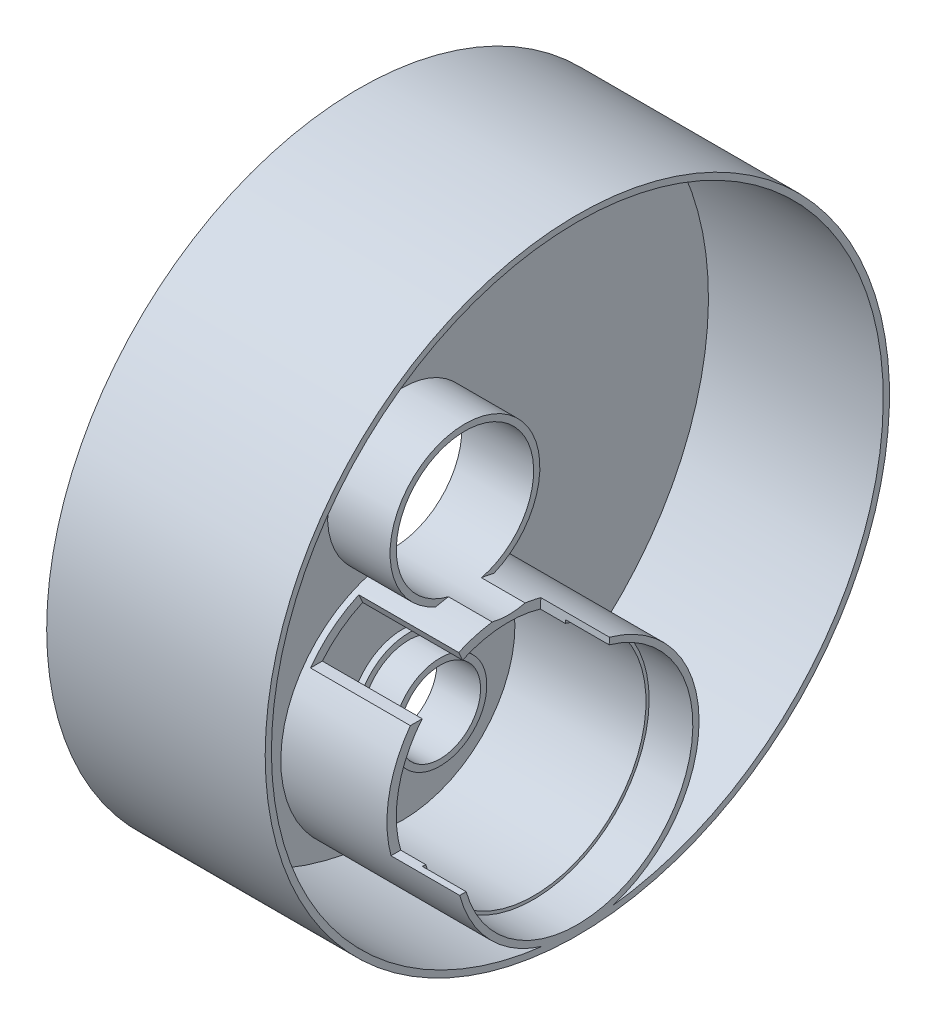
from build123d import *

# Parameters (mm, degrees)
CUT_EXTRUDE_START        = -11
CUT_EXTRUDE_1_DEPTH      = 11
CUT_EXTRUDE_2_DEPTH      = 27
EXTRUDE_START            = -1
SKETCH_4_R               = 50
SKETCH_4_R_2             = 6.5
EXTRUDE_1_DEPTH          = 1
EXTRUDE_2_DEPTH          = 6
EXTRUDE_2_DEPTH_BACK     = 29
SKETCH_5_R               = 50
SKETCH_5_R_2             = 49
EXTRUDE_3_DEPTH          = 1.5
EXTRUDE_3_DEPTH_BACK     = 10
SKETCH_15_R              = 12
SKETCH_15_R_2            = 11
CUT_EXTRUDE_4_DEPTH      = 99.407316801
CUT_EXTRUDE_4_DEPTH_BACK = 99.407316801
SKETCH_16_R              = 11
CUT_EXTRUDE_3_REACH      = 100.697
SKETCH_12_R              = 5
M2X0_41_D                = 1.6
PATTERN_CIRCULAR_1_COUNT = 3


with BuildPart() as part:
    # Эскиз1 → Повернуть1 (revolve)
    with BuildSketch(Plane.XY):
        Polygon((-27, 7.5), (-27, 8.5), (-28, 8.5), (-28, 18), (-7, 18), (-7, 18.5), (0, 18.5), (0, 19.5), (-29, 19.5), (-29, 6.5), (-22, 6.5), (-22, 7.5), align=None)
    revolve(axis=Axis((0, 0, 0), (1, 0, 0)))

    # Эскиз2 → Вырез-Вытянуть1 (cut)
    with BuildSketch(Plane(origin=(0, 0, 0), x_dir=(0, 0, -1), z_dir=(1, 0, 0)).offset(CUT_EXTRUDE_START)):
        with BuildLine():
            Line((5.156251293, 18.805931846), (5, 16.248076809))
            ThreePointArc((5, 16.248076809), (-12.02081528, 12.02081528), (-16.248076809, -5))
            Line((-16.248076809, -5), (-18.848076825, -5))
            ThreePointArc((-18.848076825, -5), (-13.731246096, 13.845680938), (5.156251293, 18.805931846))
        make_face()
    extrude(amount=CUT_EXTRUDE_1_DEPTH, mode=Mode.SUBTRACT)

    # Эскиз3 → Вырез-Вытянуть2 (cut)
    with BuildSketch(Plane(origin=(0, 0, 0), x_dir=(0, 0, -1), z_dir=(1, 0, 0))):
        with BuildLine():
            Line((-40, 11.5), (-12.519984026, 11.5))
            ThreePointArc((-12.519984026, 11.5), (-9.954045186, 13.781037132), (-6.982120022, 15.5))
            Line((-6.982120022, 15.5), (-13.240816858, 29.394032278))
            Line((-13.240816858, 29.394032278), (-40, 11.5))
        make_face()
    extrude(amount=-CUT_EXTRUDE_2_DEPTH, mode=Mode.SUBTRACT)

    # Эскиз4 → Бобышка-Вытянуть1 (add)
    with BuildSketch(Plane.ZY.offset(29).offset(EXTRUDE_START)):
        with Locations((0, 30)):
            Circle(SKETCH_4_R)
        Circle(SKETCH_4_R_2, mode=Mode.SUBTRACT)
    extrude(amount=EXTRUDE_1_DEPTH)

    # Эскиз5 → Бобышка-Вытянуть2 (add, two sides: drawn at the far end of the back side and taken through both)
    with BuildSketch(Plane.ZY.offset(29).offset(-EXTRUDE_2_DEPTH_BACK)):
        with Locations((0, 30)):
            Circle(SKETCH_5_R)
        with Locations((0, 30)):
            Circle(SKETCH_5_R_2, mode=Mode.SUBTRACT)
    extrude(amount=EXTRUDE_2_DEPTH + EXTRUDE_2_DEPTH_BACK)

    # Эскиз15 → Бобышка-Вытянуть3 (add, two sides: drawn at the far end of the back side and taken through both)
    with BuildSketch(Plane.ZY.offset(28).offset(-EXTRUDE_3_DEPTH_BACK)):
        with Locations((0, 30)):
            Circle(SKETCH_15_R)
        with Locations((0, 30)):
            Circle(SKETCH_15_R_2, mode=Mode.SUBTRACT)
    extrude(amount=EXTRUDE_3_DEPTH + EXTRUDE_3_DEPTH_BACK)

    # Эскиз16 → Вырез-Вытянуть4 (cut, two sides: drawn at the far end of the back side and taken through both)
    with BuildSketch(Plane(origin=(-28, 0, 0), x_dir=(0, 0, -1), z_dir=(1, 0, 0)).offset(-CUT_EXTRUDE_4_DEPTH_BACK)):
        with Locations((0, 30)):
            Circle(SKETCH_16_R)
    extrude(amount=CUT_EXTRUDE_4_DEPTH + CUT_EXTRUDE_4_DEPTH_BACK, mode=Mode.SUBTRACT)

    # Эскиз12 → Вырез-Вытянуть3 (cut, up to next)
    with BuildSketch(Plane.ZY.offset(29), mode=Mode.PRIVATE) as cut_extrude_3_sk1:
        with Locations((26.4, 30)):
            Circle(SKETCH_12_R)
    cut_extrude_3_tool1 = extrude(cut_extrude_3_sk1.sketch, amount=-CUT_EXTRUDE_3_REACH, mode=Mode.PRIVATE) & part.part
    add(cut_extrude_3_tool1.solids().sort_by_distance((-29, 30, 26.4))[0], mode=Mode.SUBTRACT)

    # Сверление под метчик M2x0.41 (through all)
    with Locations(Plane.ZY.offset(29)):
        with Locations((26.4, 36.5)):
            m2x0_41 = Hole(M2X0_41_D / 2)

    # Круговой массив1: Сверление под метчик M2x0.41 ×3 about axis
    pattern_circular_1_axis = Axis((0.001, 30, 26.4), (-1, 0, 0))
    for i in range(1, PATTERN_CIRCULAR_1_COUNT):
        add(m2x0_41.rotate(pattern_circular_1_axis, i * 360 / PATTERN_CIRCULAR_1_COUNT), mode=Mode.SUBTRACT)


solid = part.part
